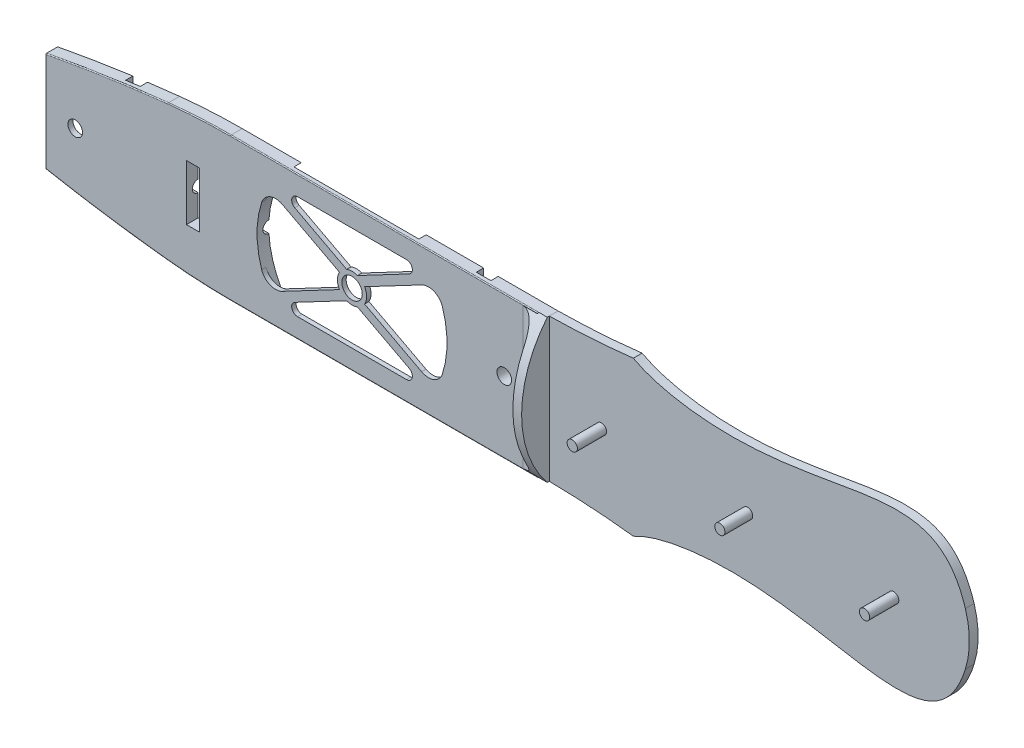
from build123d import *
from build123d.topology import SkipClean

# Parameters (mm, degrees)
BOSS_EXTRUDE1_DEPTH        = 8
FILLET2_R                  = 2
SKETCH3_R                  = 2.5
CUT_EXTRUDE1_DEPTH         = 8
SKETCH4_R                  = 3.5
CUT_EXTRUDE2_DEPTH         = 8
CUT_EXTRUDE3_DEPTH         = 2.5
CUT_EXTRUDE3_DEPTH_BACK    = 2.5
SKETCH5_R                  = 32.5
SKETCH6_W                  = 4.5
SKETCH6_H                  = 19
CUT_EXTRUDE4_DEPTH         = 10
SKETCH7_W                  = 5
SKETCH7_H                  = 5
CUT_EXTRUDE5_DEPTH         = 51
FILLET3_START              = -1
FILLET3_DEPTH              = 10
FILLET4_START              = -1
FILLET4_DEPTH              = 10
SKETCH9_W                  = 5
SKETCH9_H                  = 5
CUT_EXTRUDE6_DEPTH         = 51
CUT_EXTRUDE7_DEPTH         = 58
CUT_EXTRUDE7_DEPTH_BACK    = 22
SKETCH10_R                 = 2
FILLET5_DEPTH              = 1.5
FILLET5_START              = 6.5
FILLET5_2_DEPTH            = 1.5
CUT_EXTRUDE9_DEPTH         = 4
FILLET6_R                  = 0.3
SKETCH15_W                 = 4.5
SKETCH15_H                 = 22
CUT_EXTRUDE10_DEPTH        = 20
SKETCH16_R                 = 2.5
CUT_EXTRUDE11_DEPTH        = 10
BOSS_EXTRUDE2_DEPTH        = 3
FILLET7_R                  = 5
BOSS_EXTRUDE3_DEPTH        = 3
SKETCH20_R                 = 1.75
CUT_EXTRUDE12_DEPTH        = 3
FILLET8_R                  = 30
BOSS_EXTRUDE4_DEPTH        = 10
BOSS_EXTRUDE4_DEPTH_BACK   = 3
SKETCH21_R                 = 1.75
BOSS_EXTRUDE4_2_DEPTH      = 10
BOSS_EXTRUDE4_2_DEPTH_BACK = 3
BOSS_EXTRUDE5_DEPTH        = 9.5
BOSS_EXTRUDE5_DEPTH_BACK   = 3
SKETCH22_R                 = 1.75


with BuildPart() as part:
    # Sketch2 → Boss-Extrude1 (new body)
    with BuildSketch(Plane.XY):
        with BuildLine():
            Line((-102.95960155, 17.159933592), (-102.95960155, -17.159933592))
            add(Edge.make_bspline(
                [(-102.95960155, -17.159933592), (-76.189992309, -22.210205625), (-49.286425804, -24.488951052)],
                knots=[0, 0, 0, 0.320704871, 0.320704871, 0.320704871], degree=2))
            Line((-49.286425804, -24.488951052), (65.285160882, -24.488951052))
            Line((65.285160882, -24.488951052), (65.285160882, 24.488951052))
            Line((65.285160882, 24.488951052), (-49.286425804, 24.488951052))
            add(Edge.make_bspline(
                [(-102.95960155, 17.159933592), (-76.189992309, 22.210205625), (-49.286425804, 24.488951052)],
                knots=[0, 0, 0, 0.320704871, 0.320704871, 0.320704871], degree=2))
        make_face()
        with BuildLine():
            Line((-24.971677166, 17.771677006), (28.500163837, 17.771677006))
            Line((28.500163837, 17.771677006), (3.599814154, 4.650879462))
            ThreePointArc((3.599814154, 4.650879462), (1.764243335, 5), (-0.071327484, 4.650879462))
            Line((-0.071327484, 4.650879462), (-24.971677166, 17.771677006))
        make_face(mode=Mode.SUBTRACT)
        with BuildLine():
            Line((3.599814154, -4.650879462), (28.500163837, -17.771677006))
            Line((28.500163837, -17.771677006), (-24.971677166, -17.771677006))
            Line((-24.971677166, -17.771677006), (-0.071327484, -4.650879462))
            ThreePointArc((-0.071327484, -4.650879462), (1.764243335, -5), (3.599814154, -4.650879462))
        make_face(mode=Mode.SUBTRACT)
        with BuildLine():
            Line((-2.525196045, 2.569184657), (-26.859859934, 15.391904107))
            ThreePointArc((-26.859859934, 15.391904107), (-30.735756665, 0), (-26.859859934, -15.391904107))
            Line((-26.859859934, -15.391904107), (-2.525196045, -2.569184657))
            ThreePointArc((-2.525196045, -2.569184657), (-3.235756665, 0), (-2.525196045, 2.569184657))
        make_face(mode=Mode.SUBTRACT)
        with BuildLine():
            Line((6.053682716, -2.569184657), (30.388346604, -15.391904107))
            ThreePointArc((30.388346604, -15.391904107), (34.264243335, 0), (30.388346604, 15.391904107))
            Line((30.388346604, 15.391904107), (6.053682716, 2.569184657))
            ThreePointArc((6.053682716, 2.569184657), (6.764243335, 0), (6.053682716, -2.569184657))
        make_face(mode=Mode.SUBTRACT)
    extrude(amount=BOSS_EXTRUDE1_DEPTH)

    # Fillet2
    fillet2_edges = [part.edges().sort_by_distance(p)[0] for p in [
        (-24.971677166, 17.771677006, 4),
        (28.500163837, 17.771677006, 4),
        (-24.971677166, -17.771677006, 4),
        (28.500163837, -17.771677006, 4),
    ]]
    fillet(fillet2_edges, radius=FILLET2_R)

    # Sketch3 → Cut-Extrude1 (cut)
    with BuildSketch(Plane.XY.offset(8)):
        with Locations((53.859940094, 0)):
            Circle(SKETCH3_R)
    extrude(amount=-CUT_EXTRUDE1_DEPTH, mode=Mode.SUBTRACT)

    # Sketch4 → Cut-Extrude2 (cut)
    with BuildSketch(Plane.XY.offset(8)):
        with Locations((1.764243335, 0)):
            Circle(SKETCH4_R)
    extrude(amount=-CUT_EXTRUDE2_DEPTH, mode=Mode.SUBTRACT)

    # Sketch5 → Cut-Extrude3 (cut, two sides: drawn at the far end of the back side and taken through both)
    with SkipClean():  # the faces are left unmerged after this step: merging them gives an invalid solid
        with BuildSketch(Plane.XY.offset(4).offset(-CUT_EXTRUDE3_DEPTH_BACK)):
            with Locations((1.764243335, 0)):
                Circle(SKETCH5_R)
        extrude(amount=CUT_EXTRUDE3_DEPTH + CUT_EXTRUDE3_DEPTH_BACK, mode=Mode.SUBTRACT)

    # Sketch6 → Cut-Extrude4 (cut)
    with SkipClean():  # the faces are left unmerged after this step: merging them gives an invalid solid
        with BuildSketch(Plane.XY.offset(8)):
            with Locations((-52.644112073, 0)):
                Rectangle(SKETCH6_W, SKETCH6_H)
        extrude(amount=-CUT_EXTRUDE4_DEPTH, mode=Mode.SUBTRACT)

    # Sketch7 → Cut-Extrude5 (cut)
    with SkipClean():  # the faces are left unmerged after this step: merging them gives an invalid solid
        with BuildSketch(Plane(origin=(0, 24.488951052, 0), x_dir=(1, 0, 0), z_dir=(0, 1, 0))):
            with Locations((45.285160882, -4)):
                Rectangle(SKETCH7_W, SKETCH7_H)
        extrude(amount=-CUT_EXTRUDE5_DEPTH, mode=Mode.SUBTRACT)

    # Fillet3: read off the stored shape, not the designer's step
    # Fillet3 outline → Fillet3 (cut)
    with SkipClean():  # the faces are left unmerged after this step: merging them gives an invalid solid
        with BuildSketch(Plane.XY.offset(FILLET3_START)):
            with BuildLine():
                add(Edge.make_bspline(
                    [(-49.286425804, 24.488951052), (-55.269151656, 23.982211205), (-61.245253134, 23.338415518)],
                    knots=[0, 0, 0, 0.071317285, 0.071317285, 0.071317285], degree=2))
                ThreePointArc((-61.245253134, 23.338415518), (-50.549825889, 24.201110037), (-39.823523948, 24.488951052))
                Line((-39.823523948, 24.488951052), (-49.286425804, 24.488951052))
            make_face()
        extrude(amount=FILLET3_DEPTH, mode=Mode.SUBTRACT)

    # Fillet4: read off the stored shape, not the designer's step
    # Fillet4 outline → Fillet4 (cut)
    with SkipClean():  # the faces are left unmerged after this step: merging them gives an invalid solid
        with BuildSketch(Plane.XY.offset(FILLET4_START)):
            with BuildLine():
                Line((-49.286425804, -24.488951052), (-39.823523948, -24.488951052))
                ThreePointArc((-39.823523948, -24.488951052), (-50.549825889, -24.201110037), (-61.245253134, -23.338415518))
                add(Edge.make_bspline(
                    [(-61.245253134, -23.338415518), (-55.269151656, -23.982211205), (-49.286425804, -24.488951052)],
                    knots=[0.249387586, 0.249387586, 0.249387586, 0.320704871, 0.320704871, 0.320704871], degree=2))
            make_face()
        extrude(amount=FILLET4_DEPTH, mode=Mode.SUBTRACT)

    # Sketch9 → Cut-Extrude6 (cut)
    with SkipClean():  # the faces are left unmerged after this step: merging them gives an invalid solid
        with BuildSketch(Plane(origin=(0, 24.488951052, 0), x_dir=(1, 0, 0), z_dir=(0, 1, 0))):
            with Locations((-74.714839118, -4)):
                Rectangle(SKETCH9_W, SKETCH9_H)
        extrude(amount=-CUT_EXTRUDE6_DEPTH, mode=Mode.SUBTRACT)

    # Sketch10 → Cut-Extrude7 (cut, two sides: drawn at the far end of the back side and taken through both)
    with SkipClean():  # the faces are left unmerged after this step: merging them gives an invalid solid
        with BuildSketch(Plane.ZY.offset(50.394112073).offset(-CUT_EXTRUDE7_DEPTH_BACK)):
            with Locations(Location((4, 0, 0), (0, 0, 180))):
                Circle(SKETCH10_R)
        extrude(amount=CUT_EXTRUDE7_DEPTH + CUT_EXTRUDE7_DEPTH_BACK, mode=Mode.SUBTRACT)

    # Fillet5: read off the stored shape, not the designer's step
    # Fillet5 outline → Fillet5 (add)
    with SkipClean():  # the faces are left unmerged after this step: merging them gives an invalid solid
        with BuildSketch(Plane.XY):
            with BuildLine():
                Line((30.388346604, 15.391904107), (25.603831674, 12.87078884))
                ThreePointArc((25.603831674, 12.87078884), (29.820861326, 13.077915151), (32.692963641, 9.983198898))
                ThreePointArc((32.692963641, 9.983198898), (31.663210239, 12.739771507), (30.388346604, 15.391904107))
            make_face()
            with BuildLine():
                ThreePointArc((30.388346604, -15.391904107), (31.663210239, -12.739771507), (32.692963641, -9.983198898))
                ThreePointArc((32.692963641, -9.983198898), (29.820861326, -13.077915151), (25.603831674, -12.87078884))
                Line((25.603831674, -12.87078884), (30.388346604, -15.391904107))
            make_face()
            with BuildLine():
                Line((-26.859859934, -15.391904107), (-22.075345003, -12.87078884))
                ThreePointArc((-22.075345003, -12.87078884), (-26.292374655, -13.077915151), (-29.164476971, -9.983198898))
                ThreePointArc((-29.164476971, -9.983198898), (-28.134723569, -12.739771507), (-26.859859934, -15.391904107))
            make_face()
            with BuildLine():
                ThreePointArc((-26.859859934, 15.391904107), (-28.134723569, 12.739771507), (-29.164476971, 9.983198898))
                ThreePointArc((-29.164476971, 9.983198898), (-26.292374655, 13.077915151), (-22.075345003, 12.87078884))
                Line((-22.075345003, 12.87078884), (-26.859859934, 15.391904107))
            make_face()
        extrude(amount=FILLET5_DEPTH)

    # Fillet5 2 outline → Fillet5 2 (add)
    with SkipClean():  # the faces are left unmerged after this step: merging them gives an invalid solid
        with BuildSketch(Plane.XY.offset(FILLET5_START)):
            with BuildLine():
                Line((30.388346604, 15.391904107), (25.603831674, 12.87078884))
                ThreePointArc((25.603831674, 12.87078884), (29.820861326, 13.077915151), (32.692963641, 9.983198898))
                ThreePointArc((32.692963641, 9.983198898), (31.663210239, 12.739771507), (30.388346604, 15.391904107))
            make_face()
            with BuildLine():
                ThreePointArc((30.388346604, -15.391904107), (31.663210239, -12.739771507), (32.692963641, -9.983198898))
                ThreePointArc((32.692963641, -9.983198898), (29.820861326, -13.077915151), (25.603831674, -12.87078884))
                Line((25.603831674, -12.87078884), (30.388346604, -15.391904107))
            make_face()
            with BuildLine():
                Line((-26.859859934, -15.391904107), (-22.075345003, -12.87078884))
                ThreePointArc((-22.075345003, -12.87078884), (-26.292374655, -13.077915151), (-29.164476971, -9.983198898))
                ThreePointArc((-29.164476971, -9.983198898), (-28.134723569, -12.739771507), (-26.859859934, -15.391904107))
            make_face()
            with BuildLine():
                ThreePointArc((-26.859859934, 15.391904107), (-28.134723569, 12.739771507), (-29.164476971, 9.983198898))
                ThreePointArc((-29.164476971, 9.983198898), (-26.292374655, 13.077915151), (-22.075345003, 12.87078884))
                Line((-22.075345003, 12.87078884), (-26.859859934, 15.391904107))
            make_face()
        extrude(amount=FILLET5_2_DEPTH)


with BuildPart() as body_2:
    # Split1: read off the stored shape, not the designer's step
    # Split1: the piece on the far side of the plane
    add(part.part)
    split(bisect_by=Plane.XY.offset(4), keep=Keep.BOTTOM)

    # Sketch13 → Cut-Extrude9 (cut)
    with BuildSketch(Plane(origin=(0, 0, 0), x_dir=(-1, 0, 0), z_dir=(0, 0, -1))):
        with BuildLine():
            Line((-65.285160882, -24.488951052), (39.823523948, -24.488951052))
            ThreePointArc((39.823523948, -24.488951052), (50.549825889, -24.201110037), (61.245253134, -23.338415518))
            add(Edge.make_bspline(
                [(61.245253134, -23.338415518), (82.142929204, -21.087142885), (102.959601581, -17.159933586)],
                knots=[0, 0, 0, 1, 1, 1], degree=2))
            Line((102.959601581, -17.159933586), (102.95960155, 17.159933592))
            add(Edge.make_bspline(
                [(102.95960155, 17.159933592), (82.142929191, 21.087142887), (61.245253139, 23.338415518)],
                knots=[0, 0, 0, 1, 1, 1], degree=2))
            ThreePointArc((61.245253139, 23.338415518), (50.549825891, 24.201110037), (39.823523948, 24.488951052))
            Line((39.823523948, 24.488951052), (-65.285160882, 24.488951052))
            Line((-65.285160882, 24.488951052), (-65.285160882, -24.488951052))
        make_face()
    extrude(amount=-CUT_EXTRUDE9_DEPTH, mode=Mode.SUBTRACT)


with BuildPart() as part_1:
    add(part.part)

    # Split1
    split(bisect_by=Plane.XY.offset(4), keep=Keep.TOP)

    # Fillet6
    fillet6_edges = [part_1.edges().sort_by_distance(p)[0] for p in [
        (-82.163571081, -20.662100298, 8),
        (12.730818467, 24.488951052, 8),
        (-82.163571081, 20.662100298, 8),
        (-50.549825889, 24.201110037, 8),
        (12.730818467, -24.488951052, 8),
        (-50.549825889, -24.201110037, 8),
    ]]
    fillet(fillet6_edges, radius=FILLET6_R)

    # Sketch15 → Cut-Extrude10 (cut)
    with BuildSketch(Plane.ZY.offset(102.95960155)):
        with Locations((4, 0)):
            Rectangle(SKETCH15_W, SKETCH15_H)
    extrude(amount=-CUT_EXTRUDE10_DEPTH, mode=Mode.SUBTRACT)

    # Sketch16 → Cut-Extrude11 (cut)
    with BuildSketch(Plane.XY.offset(8)):
        with Locations((-92.95960155, 0)):
            Circle(SKETCH16_R)
    extrude(amount=-CUT_EXTRUDE11_DEPTH, mode=Mode.SUBTRACT)

    # Sketch17 → Boss-Extrude2 (add)
    with BuildSketch(Plane(origin=(65.285160882, 0, 0), x_dir=(0, 0, -1), z_dir=(1, 0, 0))):
        with BuildLine():
            Line((-7.7, -24.488951052), (-4, -24.488951052))
            Line((-4, -24.488951052), (-4, 24.488951052))
            Line((-4, 24.488951052), (-7.7, 24.488951052))
            ThreePointArc((-7.7, 24.488951052), (-16.494138822, 0), (-7.7, -24.488951052))
        make_face()
    extrude(amount=BOSS_EXTRUDE2_DEPTH)

    # Fillet7
    # the kernel refuses this fillet: 5 mm, written as the material it adds along each edge
    with BuildSketch(Plane(origin=(65.285160882, -36.620504215, 8), x_dir=(-1, 0, 0), z_dir=(0, 1, 0))) as fillet7_piece_1_section:
        with BuildLine():
            CenterArc((FILLET7_R, FILLET7_R), FILLET7_R, 180, 90)
            Line((0, FILLET7_R), (0, 0))
            Line((0, 0), (FILLET7_R, 0))
        make_face()
    fillet7_piece_1 = extrude(amount=73.241008431, mode=Mode.PRIVATE)
    fillet7_piece_1 = fillet7_piece_1 & Plane(origin=(65.285160882, 0, -22), x_dir=(0, 0.636173500729405, 0.7715460303635123), z_dir=(-1, 0, 0)) * Cylinder(38.494138822, 167, mode=Mode.PRIVATE)
    add(fillet7_piece_1)


with BuildPart() as body_2_2:
    # Sketch18 → Boss-Extrude3 (new body)
    with BuildSketch(Plane(origin=(0, 0, 4), x_dir=(-1, 0, 0), z_dir=(0, 0, -1))):
        with BuildLine():
            add(Edge.make_bspline(
                [(-97.025639537, -26.383941382), (-104.059434548, -22.531271613), (-164.629395264, -11.944702393), (-205.384951182, -45.731150855), (-212.693942599, -0.006681136)],
                knots=[0, 0, 0, 0, 0.177348709, 1, 1, 1, 1], degree=3))
            add(Edge.make_bspline(
                [(-97.025639537, 26.37057911), (-104.059434548, 22.517909341), (-164.629395264, 11.931340121), (-205.384951182, 45.717788583), (-212.693942599, -0.006681136)],
                knots=[0, 0, 0, 0, 0.177348709, 1, 1, 1, 1], degree=3))
            add(Edge.make_bspline(
                [(-68.285482775, 24.488975472), (-82.703436699, 24.67783053), (-97.025639537, 26.37057911)],
                knots=[0, 0, 0, 1, 1, 1], degree=2))
            Line((-68.285482775, 24.488975472), (-68.285482775, -24.502337744))
            add(Edge.make_bspline(
                [(-68.285482775, -24.502337744), (-82.703436699, -24.691192802), (-97.025639537, -26.383941382)],
                knots=[0, 0, 0, 1, 1, 1], degree=2))
        make_face()
    extrude(amount=-BOSS_EXTRUDE3_DEPTH)

    # Sketch20 → Cut-Extrude12 (cut)
    with BuildSketch(Plane.XY.offset(7)):
        with Locations(Location((86.130468516, 0, 0), (0, 0, 180))):
            Circle(SKETCH20_R)
        with Locations(Location((136.130468516, 0, 0), (0, 0, 180))):
            Circle(SKETCH20_R)
        with Locations(Location((186.130468516, 0, 0), (0, 0, 180))):
            Circle(SKETCH20_R)
    extrude(amount=-CUT_EXTRUDE12_DEPTH, mode=Mode.SUBTRACT)

    # Fillet8
    fillet8_edges = [body_2_2.edges().sort_by_distance(p)[0] for p in [
        (212.693942599, -0.006681136, 5.5),
    ]]
    fillet(fillet8_edges, radius=FILLET8_R)

    # Sketch22 → Boss-Extrude5 (add, two sides: drawn at the far end of the back side and taken through both)
    with BuildSketch(Plane.XY.offset(7).offset(-BOSS_EXTRUDE5_DEPTH_BACK)):
        with Locations((136.130468516, 0)):
            Circle(SKETCH22_R)
    extrude(amount=BOSS_EXTRUDE5_DEPTH + BOSS_EXTRUDE5_DEPTH_BACK)


with BuildPart() as body_3:
    # Sketch21 → Boss-Extrude4 (new, two sides: drawn at the far end of the back side and taken through both)
    with BuildSketch(Plane.XY.offset(7).offset(-BOSS_EXTRUDE4_DEPTH_BACK)):
        with Locations((86.130468516, 0)):
            Circle(SKETCH21_R)
    extrude(amount=BOSS_EXTRUDE4_DEPTH + BOSS_EXTRUDE4_DEPTH_BACK)


with BuildPart() as body_4:
    # Sketch21 → Boss-Extrude4 2 (new, two sides: drawn at the far end of the back side and taken through both)
    with BuildSketch(Plane.XY.offset(7).offset(-BOSS_EXTRUDE4_2_DEPTH_BACK)):
        with Locations((186.130468516, 0)):
            Circle(SKETCH21_R)
    extrude(amount=BOSS_EXTRUDE4_2_DEPTH + BOSS_EXTRUDE4_2_DEPTH_BACK)


solid = Compound([part_1.part, body_2_2.part, body_3.part, body_4.part])
